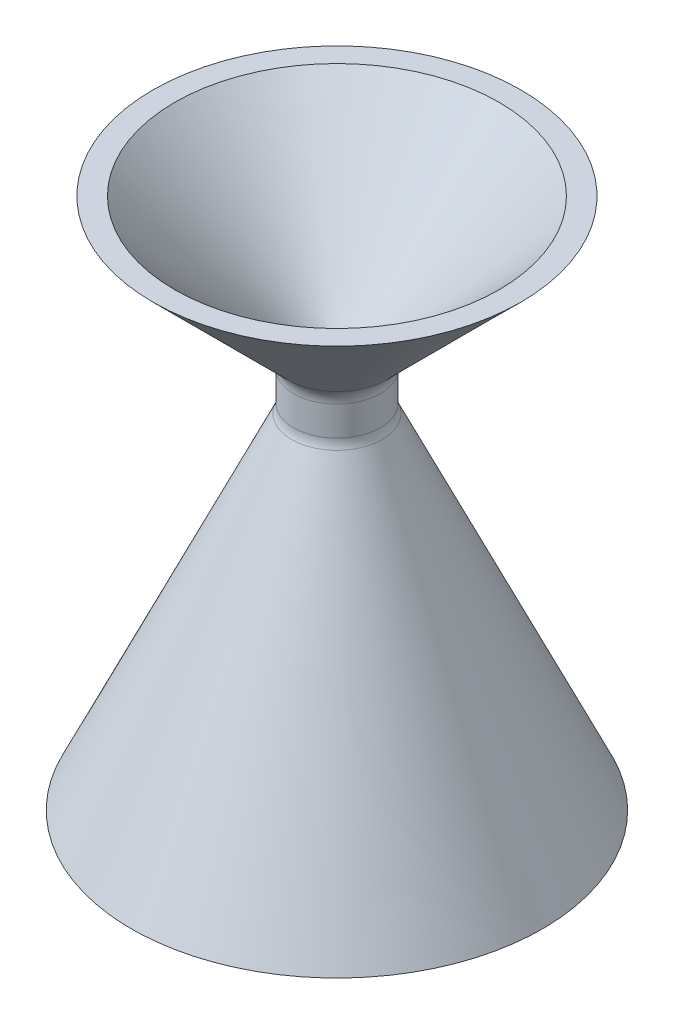
from build123d import *


with BuildPart() as part:
    # Sketch1 → Revolve1 (revolve)
    with BuildSketch(Plane.XY):
        with BuildLine():
            Line((3.175, 0.703880554), (3.175, 5.034871939))
            ThreePointArc((3.175, 5.034871939), (3.416682484, 6.249891837), (4.10493597, 7.27993597))
            Line((4.10493597, 7.27993597), (23.8125, 26.9875))
            Line((23.8125, 26.9875), (26.9875, 26.9875))
            Line((26.9875, 26.9875), (7.27993597, 7.27993597))
            ThreePointArc((7.27993597, 7.27993597), (6.591682484, 6.249891837), (6.35, 5.034871939))
            Line((6.35, 5.034871939), (6.35, 0.703880554))
            ThreePointArc((6.35, 0.703880554), (6.425260177, 0.01668478), (6.647472776, -0.637932427))
            Line((6.647472776, -0.637932427), (30.1625, -51.066071045))
            Line((30.1625, -51.066071045), (26.9875, -51.066071045))
            Line((26.9875, -51.066071045), (3.472472776, -0.637932427))
            ThreePointArc((3.472472776, -0.637932427), (3.250260177, 0.01668478), (3.175, 0.703880554))
        make_face()
    revolve(axis=Axis((0, 0, 0), (0, 1, 0)))


solid = part.part
